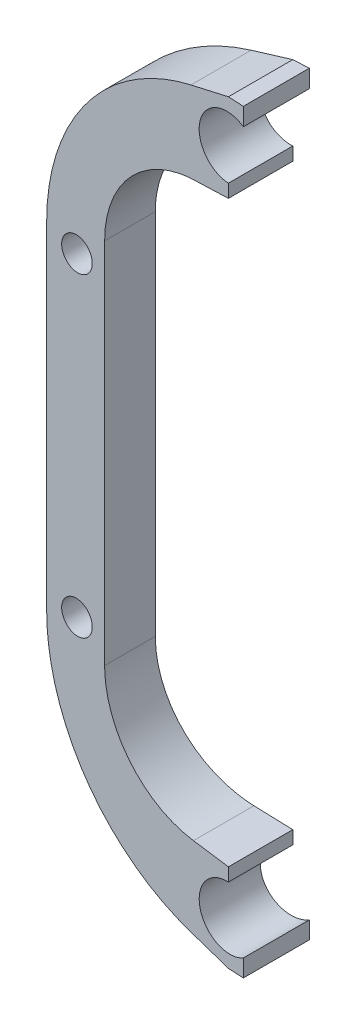
from build123d import *

# Parameters (mm, degrees)
SKETCH_1_R               = 1.1
EXTRUDE_2_DEPTH          = 4.5
FILLET_1_R               = 7
FILLET_2_R               = 14
CUT_EXTRUDE_1_DEPTH      = 33.765433725
CUT_EXTRUDE_1_DEPTH_BACK = 33.765433725


with BuildPart() as part:
    # 草图1 → 凸台-拉伸2 (new body)
    with BuildSketch(Plane.XY):
        with BuildLine():
            Line((6.017486991, 19.788810031), (-7.057549395, 16.285364591))
            Line((-7.057549395, 16.285364591), (-7.057549395, -16.139577348))
            Line((-7.057549395, -16.139577348), (-7.057549395, -28.167744528))
            Line((-7.057549395, -28.167744528), (6.017486991, -31.671189969))
            Line((6.017486991, -31.671189969), (7.089384541, -31.671189969))
            Line((7.089384541, -31.671189969), (7.089384541, -30.489226665))
            ThreePointArc((7.089384541, -30.489226665), (3.989502598, -29.231649854), (6.017486991, -26.571189969))
            Line((6.017486991, -26.571189969), (6.017486991, -25.671189969))
            Line((6.017486991, -25.671189969), (-2.887475269, -24.892106722))
            Line((-2.887475269, -24.892106722), (-2.887475269, 13.009726784))
            Line((-2.887475269, 13.009726784), (6.017486991, 13.788810031))
            Line((6.017486991, 13.788810031), (6.017486991, 14.688810031))
            ThreePointArc((6.017486991, 14.688810031), (3.988075597, 17.340711049), (7.089384541, 18.578843696))
            Line((7.089384541, 18.578843696), (7.089384541, 19.788810031))
            Line((7.089384541, 19.788810031), (6.017486991, 19.788810031))
        make_face()
        with Locations((-4.879152463, 4.788810031)):
            Circle(SKETCH_1_R, mode=Mode.SUBTRACT)
        with Locations((-4.879152463, -16.671189969)):
            Circle(SKETCH_1_R, mode=Mode.SUBTRACT)
    extrude(amount=EXTRUDE_2_DEPTH)

    # 圆角1
    fillet_1_edges = [part.edges().sort_by_distance(p)[0] for p in [
        (-2.887475269, 13.009726784, 2.25),
        (-2.887475269, -24.892106722, 2.25),
    ]]
    fillet(fillet_1_edges, radius=FILLET_1_R)

    # 圆角2
    fillet_2_edges = [part.edges().sort_by_distance(p)[0] for p in [
        (-7.057549395, 16.285364591, 2.25),
        (-7.057549395, -28.167744528, 2.25),
    ]]
    fillet(fillet_2_edges, radius=FILLET_2_R)

    # 草图2 → 切除-拉伸1 (cut, two sides: drawn at the far end of the back side and taken through both)
    with BuildSketch(Plane(origin=(0, 0, 0), x_dir=(1, 0, 0), z_dir=(0, 1, 0)).offset(-CUT_EXTRUDE_1_DEPTH_BACK)):
        Polygon((-9.937735325, -0.89235354), (-9.653427695, 2.8886559), (6.091848462, 2.8886559), (7.089384541, 0), (-4.928773799, -0.62984499), (-9.504604651, -0.62984499), align=None)
        Polygon((7.089384541, -4.5), (-9.927872999, -3.608163323), (-9.667318366, -5.613598375), (7.089384541, -5.407507841), align=None)
    extrude(amount=CUT_EXTRUDE_1_DEPTH + CUT_EXTRUDE_1_DEPTH_BACK, mode=Mode.SUBTRACT)


solid = part.part
